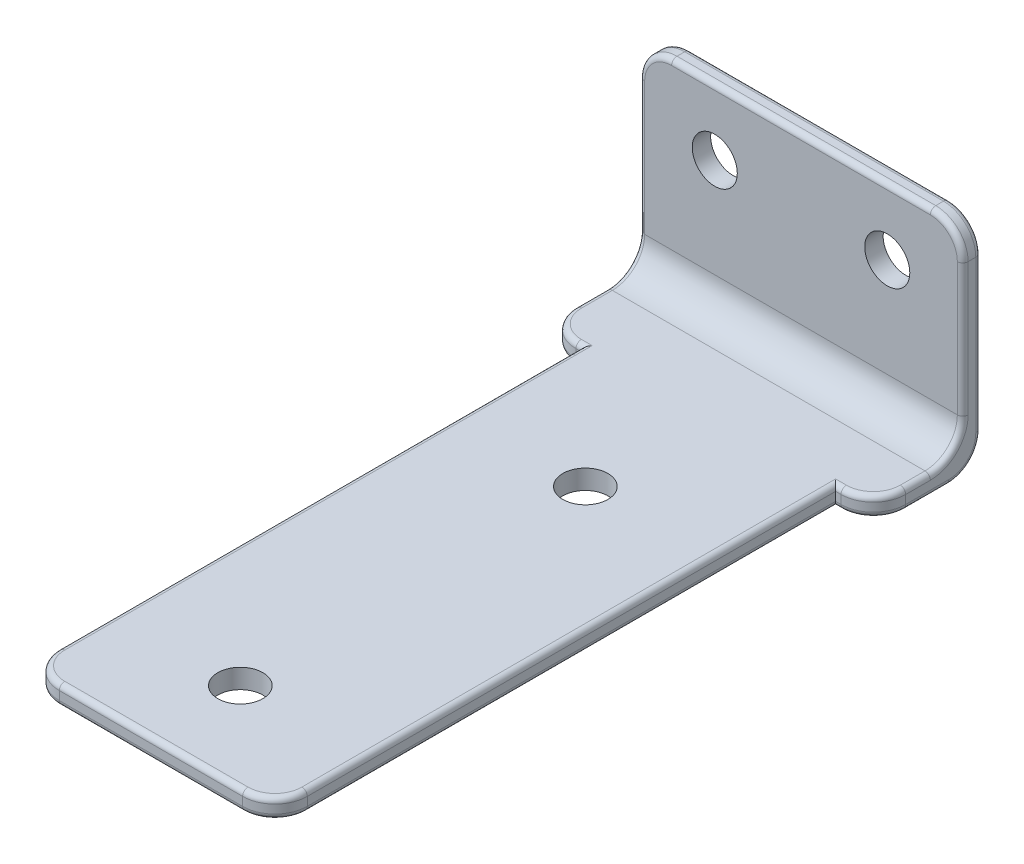
from build123d import *

# Parameters (mm, degrees)
SKETCH1_W                  = 38.1
SKETCH1_H                  = 78.74
BOSS_BASE_DEPTH            = 2.286
SKETCH3_W                  = 38.1
SKETCH3_H                  = 2.1717
BOSS_LIP_DEPTH             = 23.25116
F_4_0_209_DIAMETER_HOLE1_D = 5.3086
F_4_0_209_DIAMETER_HOLE2_D = 5.3086
SKETCH19_W                 = 4.445
SKETCH19_H                 = 66.04
SKETCH19_H_2               = 65.3034
CUT_EXTRUDE1_DEPTH         = 50.532977312
FILLET1_R                  = 3.81
FILLET4_R                  = 0.635


with BuildPart() as part:
    # Sketch1 → Boss-Base (new body)
    with BuildSketch(Plane(origin=(0, 0, 0), x_dir=(1, 0, 0), z_dir=(0, 1, 0))):
        Rectangle(SKETCH1_W, SKETCH1_H)
    extrude(amount=BOSS_BASE_DEPTH)

    # Sketch3 → Boss-Lip (add)
    with BuildSketch(Plane(origin=(0, 2.286, 0), x_dir=(1, 0, 0), z_dir=(0, 1, 0))):
        with Locations((0, 38.28415)):
            Rectangle(SKETCH3_W, SKETCH3_H)
    extrude(amount=BOSS_LIP_DEPTH)

    # #4 (0.209) Diameter Hole1 (through all)
    with Locations(Plane(origin=(0, 2.286, 0), x_dir=(1, 0, 0), z_dir=(0, 1, 0))):
        with Locations((0, -28.8417), (0, 11.7983)):
            Hole(F_4_0_209_DIAMETER_HOLE1_D / 2)

    # #4 (0.209) Diameter Hole2 (through all)
    with Locations(Plane.XY.offset(-37.1983)):
        with Locations((10.16, 17.78), (-10.16, 17.78)):
            Hole(F_4_0_209_DIAMETER_HOLE2_D / 2)

    # Sketch19 → Cut-Extrude1 (cut, through all)
    with BuildSketch(Plane(origin=(0, 2.286, 0), x_dir=(1, 0, 0), z_dir=(0, 1, 0))):
        with Locations((16.8275, -6.35)):
            Rectangle(SKETCH19_W, SKETCH19_H)
        with Locations((-16.8275, -6.7183)):
            Rectangle(SKETCH19_W, SKETCH19_H_2)
    extrude(amount=-CUT_EXTRUDE1_DEPTH, mode=Mode.SUBTRACT)

    # Fillet1
    fillet1_edges = [part.edges().sort_by_distance(p)[0] for p in [
        (-19.05, 1.143, -25.9334),
        (19.05, 1.143, -26.67),
        (14.605, 1.143, 39.37),
        (-14.605, 1.143, 39.37),
        (-19.05, 25.53716, -38.28415),
        (19.05, 25.53716, -38.28415),
        (0, 0, -39.37),
        (0, 2.286, -37.1983),
    ]]
    fillet(fillet1_edges, radius=FILLET1_R)

    # Fillet4
    fillet4_edges = [part.edges().sort_by_distance(p)[0] for p in [
        (17.934076836, 24.421236836, -37.1983),
        (-17.934076836, 24.421236836, -37.1983),
        (17.934076836, 24.421236836, -39.37),
        (-17.934076836, 24.421236836, -39.37),
        (13.489076836, 0, 38.254076836),
        (-13.489076836, 0, 38.254076836),
        (13.489076836, 2.286, 38.254076836),
        (-13.489076836, 2.286, 38.254076836),
        (19.05, 13.91158, -37.1983),
        (19.05, 12.76858, -39.37),
        (0, 25.53716, -37.1983),
        (0, 25.53716, -39.37),
        (-19.05, 13.91158, -37.1983),
        (-19.05, 12.76858, -39.37),
        (0, 0, 39.37),
        (0, 2.286, 39.37),
        (14.605, 0, 4.445),
        (14.605, 2.286, 4.445),
        (-14.605, 0, 4.8133),
        (-14.605, 2.286, 4.8133),
        (17.934076836, 0, -27.785923164),
        (-17.934076836, 0, -27.049323164),
        (-17.934076836, 2.286, -27.049323164),
        (19.05, 0, -33.02),
        (-19.05, 0, -32.6517),
        (-19.05, 2.286, -31.56585),
        (17.934076836, 2.286, -27.785923164),
        (19.05, 2.286, -31.93415),
        (19.05, 1.115923164, -38.254076836),
        (-19.05, 1.115923164, -38.254076836),
        (19.05, 3.401923164, -36.082376836),
        (-19.05, 3.401923164, -36.082376836),
        (14.9225, 2.286, -26.67),
        (-14.9225, 2.286, -25.9334),
        (14.9225, 0, -26.67),
        (-14.9225, 0, -25.9334),
    ]]
    fillet(fillet4_edges, radius=FILLET4_R)


solid = part.part
